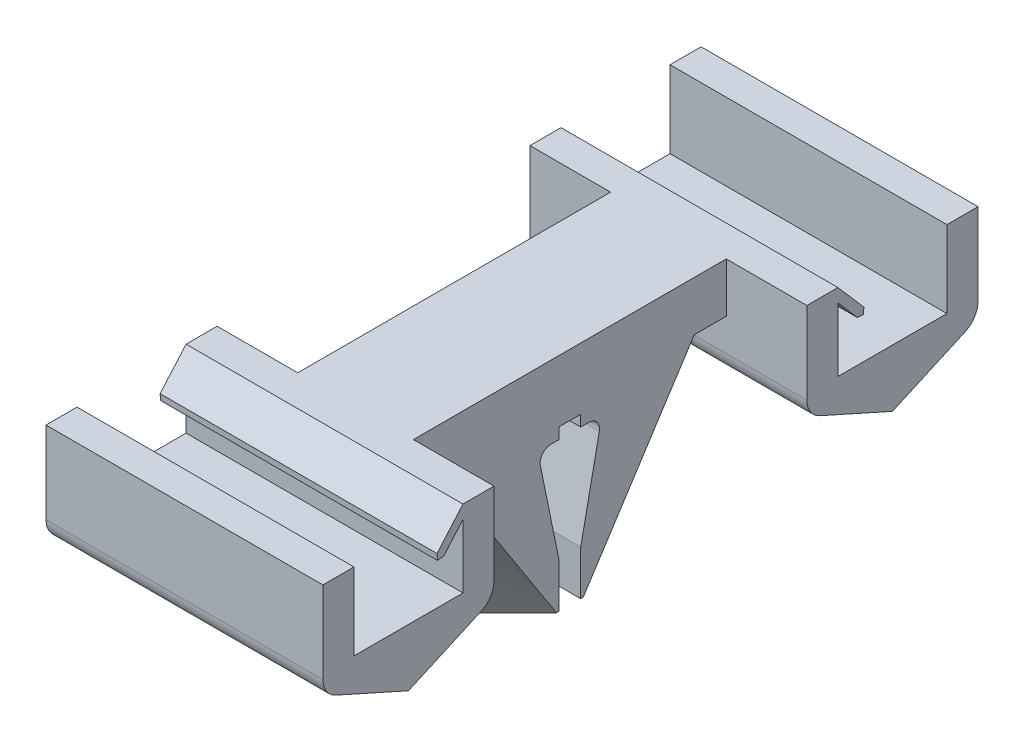
from build123d import *

# Parameters (mm, degrees)
TUBE_GRIPPERS_DEPTH   = 12.7
TUBE_GRIPPERS_2_DEPTH = 12.7
BOSS_EXTRUDE2_REACH   = 28.354
METAL_GROOVE_REACH    = 22.346


with BuildPart() as part:
    # Sketch1 → Tube grippers (new body)
    with BuildSketch(Plane(origin=(0, 0, 0), x_dir=(0, 0, -1), z_dir=(1, 0, 0))):
        with BuildLine():
            Line((9.486244212, -1.828950085), (8.598987503, -0.805898646))
            Line((8.598987503, -0.805898646), (8.598987503, -3.728262134))
            Line((8.598987503, -3.728262134), (13.598987503, -3.728262134))
            Line((13.598987503, -3.728262134), (13.598987503, -0.195387445))
            Line((13.598987503, -0.195387445), (15.023001307, -0.195387445))
            Line((15.023001307, -0.195387445), (15.023001307, -3.958844194))
            ThreePointArc((15.023001307, -3.958844194), (14.862234402, -4.502616031), (14.431625685, -4.871546839))
            Line((14.431625685, -4.871546839), (11.098987503, -6.363595987))
            Line((11.098987503, -6.363595987), (7.766349322, -4.871546839))
            ThreePointArc((7.766349322, -4.871546839), (7.335740604, -4.502616031), (7.1749737, -3.958844194))
            Line((7.1749737, -3.958844194), (7.1749737, -0.195387445))
            Line((7.1749737, -0.195387445), (8.598987503, -0.195387445))
            Line((8.598987503, -0.195387445), (9.788430341, -1.566874631))
            Line((9.788430341, -1.566874631), (9.768375004, -1.849005422))
            Line((9.768375004, -1.849005422), (9.486244212, -1.828950085))
        make_face()
    extrude(amount=TUBE_GRIPPERS_DEPTH)


with BuildPart() as body_2:
    # Sketch1 → Tube grippers 2 (new body)
    with BuildSketch(Plane(origin=(0, 0, 0), x_dir=(0, 0, -1), z_dir=(1, 0, 0))):
        with BuildLine():
            Line((-8.598987503, -0.195387445), (-7.1749737, -0.195387445))
            Line((-7.1749737, -0.195387445), (-7.1749737, -3.958844194))
            ThreePointArc((-7.1749737, -3.958844194), (-7.335740604, -4.502616031), (-7.766349322, -4.871546839))
            Line((-7.766349322, -4.871546839), (-11.098987503, -6.363595987))
            Line((-11.098987503, -6.363595987), (-14.431625685, -4.871546839))
            ThreePointArc((-14.431625685, -4.871546839), (-14.862234402, -4.502616031), (-15.023001307, -3.958844194))
            Line((-15.023001307, -3.958844194), (-15.023001307, -0.195387445))
            Line((-15.023001307, -0.195387445), (-13.598987503, -0.195387445))
            Line((-13.598987503, -0.195387445), (-13.598987503, -3.728262134))
            Line((-13.598987503, -3.728262134), (-8.598987503, -3.728262134))
            Line((-8.598987503, -3.728262134), (-8.598987503, -0.805898646))
            Line((-8.598987503, -0.805898646), (-9.486244212, -1.828950085))
            Line((-9.486244212, -1.828950085), (-9.768375004, -1.849005422))
            Line((-9.768375004, -1.849005422), (-9.788430341, -1.566874631))
            Line((-9.788430341, -1.566874631), (-8.598987503, -0.195387445))
        make_face()
    extrude(amount=TUBE_GRIPPERS_2_DEPTH)

    # Sketch2 → Boss-Extrude2 (add, up to next)
    with BuildSketch(Plane.XY.offset(-7.1749737), mode=Mode.PRIVATE) as boss_extrude2_sk1:
        Polygon((3.697394281, -0.195387445), (9.002605719, -0.195387445), (9.002605719, -2.472156441), (6.35, -3.687707332), (3.697394281, -2.472156441), align=None)
    boss_extrude2_tool1 = extrude(boss_extrude2_sk1.sketch, amount=BOSS_EXTRUDE2_REACH, mode=Mode.PRIVATE) - body_2.part

    add(part.part)  # Boss-Extrude2 merges part
    add(boss_extrude2_tool1.solids().sort_by_distance((6.35, -1.659003, -7.174974))[0])

    # Sketch5 → Metal gripper section 0
    with BuildSketch(Plane(origin=(0, -0.195387445, 0), x_dir=(1, 0, 0), z_dir=(0, 1, 0))):
        with BuildLine():
            Line((9.002605719, 7.17620667), (9.002605719, -7.17620667))
            Line((9.002605719, -7.17620667), (6.35, -8.386155632))
            Line((6.35, -8.386155632), (3.697394281, -7.17620667))
            Line((3.697394281, -7.17620667), (3.697394281, 7.17620667))
            Line((3.697394281, 7.17620667), (6.35, 8.386155632))
            Line((6.35, 8.386155632), (9.002605719, 7.17620667))
        make_face()
    # Sketch6 → Metal gripper section 1
    with BuildSketch(Plane(origin=(0, -10.355387445, 0), x_dir=(1, 0, 0), z_dir=(0, 1, 0))):
        with BuildLine():
            Line((6.35, -3.265294175), (3.697394281, -0.612688456))
            Line((3.697394281, -0.612688456), (3.697394281, 0.612688456))
            Line((3.697394281, 0.612688456), (6.35, 3.265294175))
            Line((6.35, 3.265294175), (9.002605719, 0.612688456))
            Line((9.002605719, 0.612688456), (9.002605719, -0.612688456))
            Line((9.002605719, -0.612688456), (6.35, -3.265294175))
        make_face()
    loft()

    # Sketch4 → Metal groove (cut, up to next)
    with BuildSketch(Plane.ZY.offset(-3.697394281), mode=Mode.PRIVATE) as metal_groove_sk1:
        with BuildLine():
            Line((0.863271786, -3.536832517), (0.5, -3.536832517))
            Line((0.5, -3.536832517), (0.5, -3.028389789))
            Line((0.5, -3.028389789), (-0.5, -3.028389789))
            Line((-0.5, -3.028389789), (-0.5, -3.536832517))
            Line((-0.5, -3.536832517), (-0.863271786, -3.536832517))
            ThreePointArc((-0.863271786, -3.536832517), (-1.250652611, -3.720705808), (-1.353117488, -4.137088131))
            Line((-1.353117488, -4.137088131), (-0.5, -8.3053927))
            Line((-0.5, -8.3053927), (-0.5, -12.003161214))
            Line((-0.5, -12.003161214), (0.5, -12.003161214))
            Line((0.5, -12.003161214), (0.5, -8.3053927))
            Line((0.5, -8.3053927), (1.353117488, -4.137088131))
            ThreePointArc((1.353117488, -4.137088131), (1.250652611, -3.720705808), (0.863271786, -3.536832517))
        make_face()
    metal_groove_tool1 = extrude(metal_groove_sk1.sketch, amount=-METAL_GROOVE_REACH, mode=Mode.PRIVATE) & body_2.part
    add(metal_groove_tool1.solids().sort_by_distance((3.697394, -6.737927, 0))[0], mode=Mode.SUBTRACT)


solid = body_2.part
